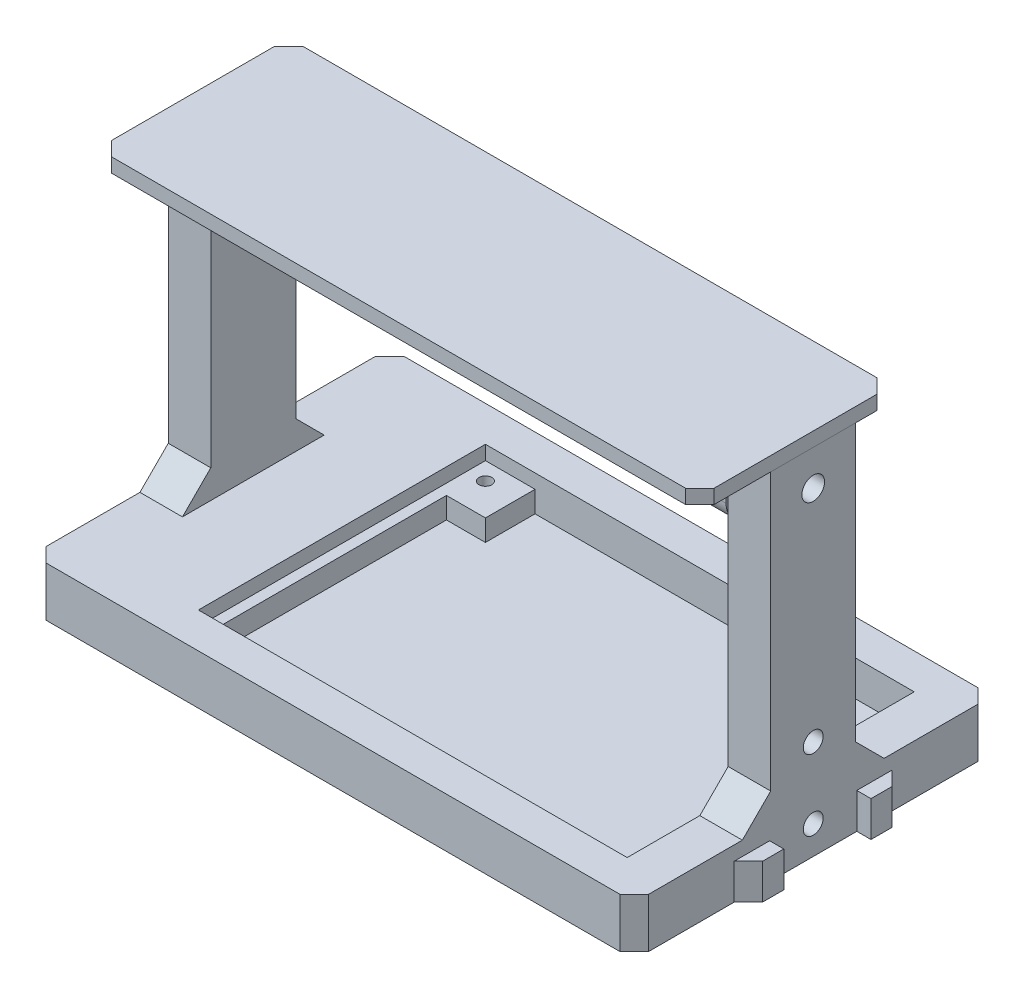
from build123d import *

# Parameters (mm, degrees)
SCHIZZO1_W                    = 85
SCHIZZO1_H                    = 50.5
SCHIZZO1_W_2                  = 60.5
SCHIZZO1_H_2                  = 40.5
ESTRUSIONE_ESTRUSIONE1_DEPTH  = 7
SCHIZZO1_3_W                  = 60.5
SCHIZZO1_3_H                  = 40.5
ESTRUSIONE_ESTRUSIONE2_DEPTH  = 2
SCHIZZO3_W                    = 1.5
SCHIZZO3_H                    = 40.5
ESTRUSIONE_ESTRUSIONE3_DEPTH  = 3
SCHIZZO4_W                    = 12
SCHIZZO4_H                    = 43
ESTRUSIONE_ESTRUSIONE4_DEPTH  = 6
ESTRUSIONE_ESTRUSIONE5_START  = -85
SCHIZZO4_2_W                  = 12
SCHIZZO4_2_H                  = 43
ESTRUSIONE_ESTRUSIONE5_DEPTH  = 6
SCHIZZO5_R                    = 1.4
TAGLIO_ESTRUSIONE1_DEPTH      = 5.5
SMUSSO1_SIZE                  = 4
SCHIZZO7_W                    = 3
SCHIZZO7_H                    = 5
ESTRUSIONE_ESTRUSIONE6_DEPTH  = 2
SMUSSO2_SIZE                  = 2
SMUSSO3_SIZE                  = 2
SCHIZZO8_W                    = 5
SCHIZZO8_H                    = 1
ESTRUSIONE_ESTRUSIONE7_DEPTH  = 1
SMUSSO4_SIZE                  = 1
SCHIZZO9_W                    = 5.5
SCHIZZO9_H                    = 7
ESTRUSIONE_ESTRUSIONE8_DEPTH  = 3
SCHIZZO10_R                   = 0.9
TAGLIO_ESTRUSIONE2_DEPTH      = 4
SCHIZZO11_R                   = 1.6
TAGLIO_ESTRUSIONE3_DEPTH      = 104.472520507
SCHIZZO13_W                   = 85
SCHIZZO13_H                   = 27
ESTRUSIONE_ESTRUSIONE10_DEPTH = 2
SCHIZZO15_W                   = 5
SCHIZZO15_H                   = 12
ESTRUSIONE_ESTRUSIONE11_DEPTH = 10
SCHIZZO16_R                   = 1.35
TAGLIO_ESTRUSIONE4_DEPTH      = 100.267580307
RACCORDO1_R                   = 3
SMUSSO5_SIZE                  = 2


with BuildPart() as part:
    # Schizzo1 → Estrusione-Estrusione1 (new body)
    with BuildSketch(Plane(origin=(0, 0, 0), x_dir=(1, 0, 0), z_dir=(0, 1, 0))):
        Rectangle(SCHIZZO1_W, SCHIZZO1_H)
        with Locations((6.25, 0)):
            Rectangle(SCHIZZO1_W_2, SCHIZZO1_H_2, mode=Mode.SUBTRACT)
    extrude(amount=ESTRUSIONE_ESTRUSIONE1_DEPTH)

    # Schizzo1<3> → Estrusione-Estrusione2 (add)
    with BuildSketch(Plane(origin=(0, 0, 0), x_dir=(1, 0, 0), z_dir=(0, 1, 0))):
        with Locations((6.25, 0)):
            Rectangle(SCHIZZO1_3_W, SCHIZZO1_3_H)
    extrude(amount=ESTRUSIONE_ESTRUSIONE2_DEPTH)

    # Schizzo3 → Estrusione-Estrusione3 (add)
    with BuildSketch(Plane(origin=(0, 2, 0), x_dir=(1, 0, 0), z_dir=(0, 1, 0))):
        with Locations((-23.25, 0)):
            Rectangle(SCHIZZO3_W, SCHIZZO3_H)
        with Locations((35.75, 0)):
            Rectangle(SCHIZZO3_W, SCHIZZO3_H)
    extrude(amount=ESTRUSIONE_ESTRUSIONE3_DEPTH)

    # Schizzo4 → Estrusione-Estrusione4 (add)
    with BuildSketch(Plane(origin=(42.5, 0, 0), x_dir=(0, 0, -1), z_dir=(1, 0, 0))):
        with Locations((0, 28.5)):
            Rectangle(SCHIZZO4_W, SCHIZZO4_H)
    extrude(amount=-ESTRUSIONE_ESTRUSIONE4_DEPTH)

    # Schizzo4<2> → Estrusione-Estrusione5 (add)
    with BuildSketch(Plane(origin=(42.5, 0, 0), x_dir=(0, 0, -1), z_dir=(1, 0, 0)).offset(ESTRUSIONE_ESTRUSIONE5_START)):
        with Locations((0, 28.5)):
            Rectangle(SCHIZZO4_2_W, SCHIZZO4_2_H)
    extrude(amount=ESTRUSIONE_ESTRUSIONE5_DEPTH)

    # Schizzo5 → Taglio-Estrusione1 (cut)
    with BuildSketch(Plane(origin=(42.5, 0, 0), x_dir=(0, 0, -1), z_dir=(1, 0, 0))):
        with Locations((0, 4)):
            Circle(SCHIZZO5_R)
        with Locations((0, 14)):
            Circle(SCHIZZO5_R)
    taglio_estrusione1 = extrude(amount=-TAGLIO_ESTRUSIONE1_DEPTH, mode=Mode.SUBTRACT)

    # Specchia1: Taglio-Estrusione1 across plane
    add(taglio_estrusione1.mirror(Plane(origin=(0, 0, 0), x_dir=(0, 0, 1), z_dir=(1, 0, 0))), mode=Mode.SUBTRACT)

    # Smusso1
    smusso1_edges = [part.edges().sort_by_distance(p)[0] for p in [
        (39.5, 7, -6),
        (39.5, 7, 6),
        (-39.5, 7, 6),
        (-39.5, 7, -6),
    ]]
    chamfer(smusso1_edges, length=SMUSSO1_SIZE)

    # Schizzo7 → Estrusione-Estrusione6 (add)
    with BuildSketch(Plane(origin=(42.5, 0, 0), x_dir=(0, 0, -1), z_dir=(1, 0, 0))):
        with Locations((-7.65, 2.5)):
            Rectangle(SCHIZZO7_W, SCHIZZO7_H)
        with Locations((7.65, 2.5)):
            Rectangle(SCHIZZO7_W, SCHIZZO7_H)
    estrusione_estrusione6 = extrude(amount=ESTRUSIONE_ESTRUSIONE6_DEPTH)

    # Specchia2: Estrusione-Estrusione6 across plane
    add(estrusione_estrusione6.mirror(Plane(origin=(0, 0, 0), x_dir=(0, 0, 1), z_dir=(1, 0, 0))))

    # Smusso2
    smusso2_edges = [part.edges().sort_by_distance(p)[0] for p in [
        (42.5, 2.5, -9.15),
        (42.5, 2.5, 9.15),
        (-42.5, 2.5, -9.15),
        (-42.5, 2.5, 9.15),
    ]]
    chamfer(smusso2_edges, length=SMUSSO2_SIZE - 0.0001)  # a hair under: the kernel refuses the full size

    # Smusso3
    smusso3_edges = [part.edges().sort_by_distance(p)[0] for p in [
        (42.5, 3.5, 25.25),
        (-42.5, 3.5, 25.25),
        (-42.5, 3.5, -25.25),
        (42.5, 3.5, -25.25),
    ]]
    chamfer(smusso3_edges, length=SMUSSO3_SIZE)

    # Schizzo8 → Estrusione-Estrusione7 (add)
    with BuildSketch(Plane.ZY.offset(-36.5)):
        with Locations((0, 7.2)):
            Rectangle(SCHIZZO8_W, SCHIZZO8_H)
    extrude(amount=ESTRUSIONE_ESTRUSIONE7_DEPTH)

    # Smusso4
    smusso4_edges = [part.edges().sort_by_distance(p)[0] for p in [
        (36.5, 7.7, 0),
    ]]
    chamfer(smusso4_edges, length=SMUSSO4_SIZE - 0.0001)  # a hair under: the kernel refuses the full size

    # Schizzo9 → Estrusione-Estrusione8 (add)
    with BuildSketch(Plane(origin=(0, 2, 0), x_dir=(1, 0, 0), z_dir=(0, 1, 0))):
        with Locations((-19.75, 16.75)):
            Rectangle(SCHIZZO9_W, SCHIZZO9_H)
    extrude(amount=ESTRUSIONE_ESTRUSIONE8_DEPTH)

    # Schizzo10 → Taglio-Estrusione2 (cut)
    with BuildSketch(Plane(origin=(0, 5, 0), x_dir=(1, 0, 0), z_dir=(0, 1, 0))):
        with Locations(Location((-21.5, 17.75, 0), (0, 0, 270))):
            Circle(SCHIZZO10_R)
    extrude(amount=-TAGLIO_ESTRUSIONE2_DEPTH, mode=Mode.SUBTRACT)

    # Schizzo11 → Taglio-Estrusione3 (cut, through all)
    with BuildSketch(Plane(origin=(42.5, 0, 0), x_dir=(0, 0, -1), z_dir=(1, 0, 0))):
        with Locations((0, 45)):
            Circle(SCHIZZO11_R)
    extrude(amount=-TAGLIO_ESTRUSIONE3_DEPTH, mode=Mode.SUBTRACT)


with BuildPart() as body_2:
    # Schizzo13 → Estrusione-Estrusione10 (new body)
    with BuildSketch(Plane(origin=(0, 50, 0), x_dir=(1, 0, 0), z_dir=(0, 1, 0))):
        with Locations((0, -2.5)):
            Rectangle(SCHIZZO13_W, SCHIZZO13_H)
    extrude(amount=ESTRUSIONE_ESTRUSIONE10_DEPTH)

    # Schizzo15 → Estrusione-Estrusione11 (add)
    with BuildSketch(Plane.XZ.offset(-50)):
        with Locations((-33.7, 0)):
            Rectangle(SCHIZZO15_W, SCHIZZO15_H)
    estrusione_estrusione11 = extrude(amount=ESTRUSIONE_ESTRUSIONE11_DEPTH)

    # Specchia4: Estrusione-Estrusione11 across plane
    add(estrusione_estrusione11.mirror(Plane(origin=(0, 0, 0), x_dir=(0, 0, 1), z_dir=(1, 0, 0))))

    # Schizzo16 → Taglio-Estrusione4 (cut, through all)
    with BuildSketch(Plane(origin=(36.2, 0, 0), x_dir=(0, 0, -1), z_dir=(1, 0, 0))):
        with Locations((0, 45)):
            Circle(SCHIZZO16_R)
    extrude(amount=-TAGLIO_ESTRUSIONE4_DEPTH, mode=Mode.SUBTRACT)

    # Raccordo1
    raccordo1_edges = [body_2.edges().sort_by_distance(p)[0] for p in [
        (-33.7, 40, -6),
        (-33.7, 40, 6),
        (33.7, 40, 6),
        (33.7, 40, -6),
    ]]
    fillet(raccordo1_edges, radius=RACCORDO1_R)

    # Smusso5
    smusso5_edges = [body_2.edges().sort_by_distance(p)[0] for p in [
        (-42.5, 51, -11),
        (42.5, 51, -11),
        (42.5, 51, 16),
        (-42.5, 51, 16),
    ]]
    chamfer(smusso5_edges, length=SMUSSO5_SIZE)


solid = Compound([part.part, body_2.part])
